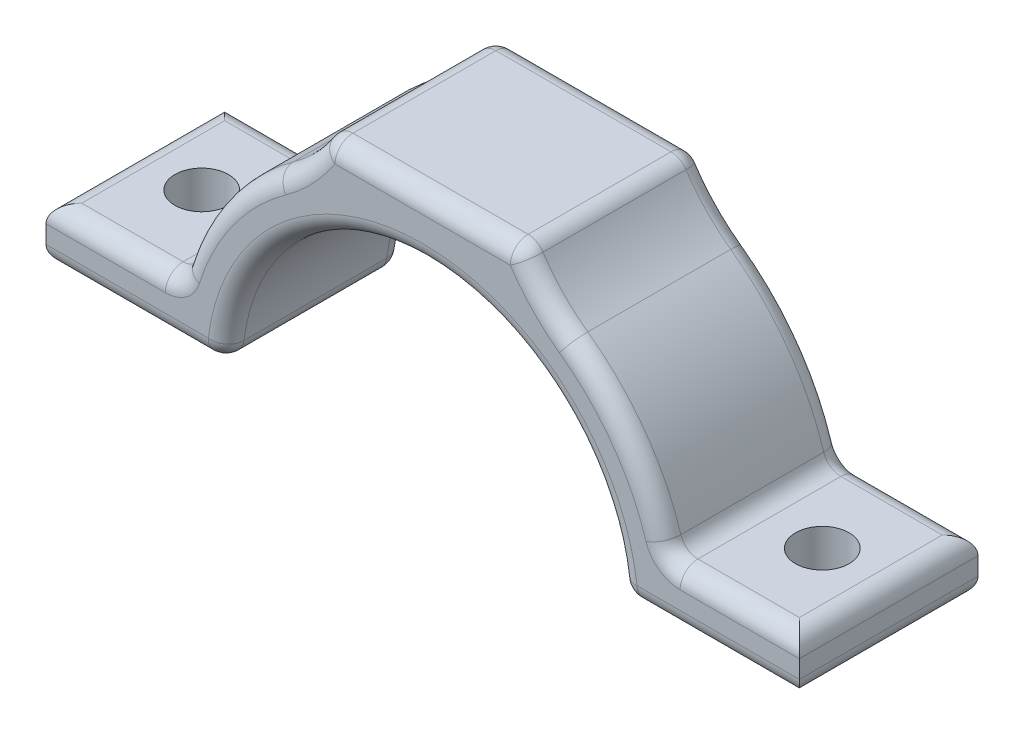
from build123d import *

# Parameters (mm, degrees)
BOSS_EXTRUDE1_DEPTH = 10
CUT_EXTRUDE1_REACH  = 27.796
SKETCH2_R           = 1.5
FILLET1_R           = 10
FILLET2_R           = 1


with BuildPart() as part:
    # Sketch1 → Boss-Extrude1 (new body)
    with BuildSketch(Plane.XY):
        with BuildLine():
            Line((-5.459853478, 13), (-5.459853478, 14.5))
            Line((-5.459853478, 14.5), (5.459853478, 14.5))
            Line((5.459853478, 14.5), (5.459853478, 13))
            ThreePointArc((5.459853478, 13), (10.669887711, 9.21756455), (13.655283113, 3.513295191))
            Line((13.655283113, 3.513295191), (21.088125543, 3.513295191))
            Line((21.088125543, 3.513295191), (21.088125543, 0.513295191))
            Line((21.088125543, 0.513295191), (11.088125543, 0.513295191))
            ThreePointArc((11.088125543, 0.513295191), (0, 11.1), (-11.088125543, 0.513295191))
            Line((-11.088125543, 0.513295191), (-21.088125543, 0.513295191))
            Line((-21.088125543, 0.513295191), (-21.088125543, 3.513295191))
            Line((-21.088125543, 3.513295191), (-13.655283113, 3.513295191))
            ThreePointArc((-13.655283113, 3.513295191), (-10.669887711, 9.21756455), (-5.459853478, 13))
        make_face()
    extrude(amount=BOSS_EXTRUDE1_DEPTH)

    # Sketch2 → Cut-Extrude1 (cut, up to next)
    with BuildSketch(Plane(origin=(0, 3.513295191, 0), x_dir=(1, 0, 0), z_dir=(0, 1, 0)), mode=Mode.PRIVATE) as cut_extrude1_sk1:
        with Locations(Location((-17.371704328, -5, 0), (0, 0, 180))):
            Circle(SKETCH2_R)
    cut_extrude1_tool1 = extrude(cut_extrude1_sk1.sketch, amount=-CUT_EXTRUDE1_REACH, mode=Mode.PRIVATE) & part.part
    # Sketch2 → Cut-Extrude1 (cut, up to next)
    with BuildSketch(Plane(origin=(0, 3.513295191, 0), x_dir=(1, 0, 0), z_dir=(0, 1, 0)), mode=Mode.PRIVATE) as cut_extrude1_sk2:
        with Locations(Location((17.371704328, -5, 0), (0, 0, 180))):
            Circle(SKETCH2_R)
    cut_extrude1_tool2 = extrude(cut_extrude1_sk2.sketch, amount=-CUT_EXTRUDE1_REACH, mode=Mode.PRIVATE) & part.part
    add(cut_extrude1_tool1.solids().sort_by_distance((-17.371704, 3.513295, 5))[0], mode=Mode.SUBTRACT)
    add(cut_extrude1_tool2.solids().sort_by_distance((17.371704, 3.513295, 5))[0], mode=Mode.SUBTRACT)

    # Fillet1
    # the kernel refuses this fillet: 10 mm, written as the material it adds along each edge
    with BuildSketch(Plane(origin=(5.459853478, 13, 0), x_dir=(0, 1, 0), z_dir=(0, 0, 1))) as fillet1_piece_1:
        with BuildLine():
            CenterArc((6.552206942, -8.629901796), FILLET1_R, 120.346003633, 23.876636028)
            Line((-1.560741996, -2.783530313), (-1.723000975, -2.666602883))
            ThreePointArc((-1.723000975, -2.666602883), (-0.875816916, -1.338248063), (-0.184397163, 0.07744473))
            Line((-0.184397163, 0.07744473), (0, 0.2))
            ThreePointArc((0, 0.2), (0.75, 0.2), (1.398955861, 0.172598036))
            Line((1.398955861, 0.172598036), (1.5, 0))
        make_face()
    extrude(amount=10)
    with BuildSketch(Plane(origin=(-5.459853478, 13, 0), x_dir=(-0.8722433873059962, -0.4890720532814792, 0), z_dir=(0, 0, 1))) as fillet1_piece_2:
        with BuildLine():
            CenterArc((4.322873472, -9.935762969), FILLET1_R, 96.497751777, 23.876636028)
            Line((-0.73360808, -1.308365081), (-0.834737711, -1.135817123))
            ThreePointArc((-0.834737711, -1.135817123), (-0.541252717, -0.55636813), (-0.174448677, 0.097814411))
            Line((-0.174448677, 0.097814411), (0.022632845, 0.198715259))
            ThreePointArc((0.022632845, 0.198715259), (1.595615601, 0.109425786), (3.168598356, 0.198715259))
            Line((3.168598356, 0.198715259), (3.191231202, 0))
        make_face()
    extrude(amount=10)

    # Fillet2
    fillet2_edges = [part.edges().sort_by_distance(p)[0] for p in [
        (16.088125543, 0.513295191, 0),
        (0, 11.1, 0),
        (11.644446087, 7.950904057, 10),
        (-16.088125543, 0.513295191, 0),
        (-17.371704328, 3.513295191, 0),
        (0, 14.5, 0),
        (11.644446087, 7.950904057, 0),
        (17.371704328, 3.513295191, 0),
        (21.088125543, 0.513295191, 5),
        (11.088125543, 0.513295191, 5),
        (-11.088125543, 0.513295191, 5),
        (0, 14.5, 10),
        (-21.088125543, 0.513295191, 5),
        (-21.088125543, 3.513295191, 5),
        (-13.655283113, 3.513295191, 5),
        (-5.459853478, 14.5, 5),
        (5.459853478, 14.5, 5),
        (13.655283113, 3.513295191, 5),
        (21.088125543, 3.513295191, 5),
        (-17.371704328, 3.513295191, 10),
        (-16.088125543, 0.513295191, 10),
        (-11.644446087, 7.950904057, 0),
        (-11.644446087, 7.950904057, 10),
        (0, 11.1, 10),
        (6.691602977, 12.824105977, 0),
        (6.691602977, 12.824105977, 10),
        (-6.691602977, 12.824105977, 0),
        (-6.691602977, 12.824105977, 10),
        (16.088125543, 0.513295191, 10),
        (17.371704328, 3.513295191, 10),
    ]]
    fillet(fillet2_edges, radius=FILLET2_R)


solid = part.part
